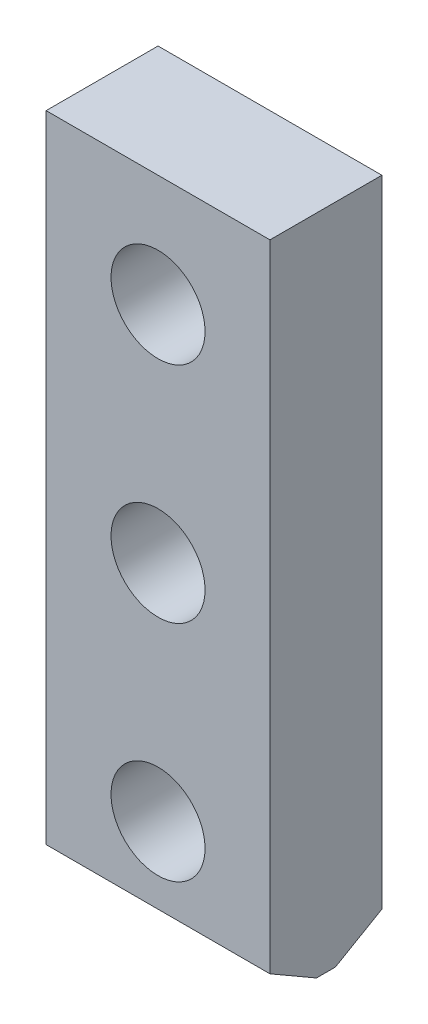
from build123d import *

# Parameters (mm, degrees)
SKETCH_1_W          = 50
SKETCH_1_H          = 148
EXTRUDE_1_DEPTH     = 25
SKETCH_2_R          = 10.5
CUT_EXTRUDE_1_DEPTH = 159.205562481
CHAMFER_1_SIZE      = 6
CHAMFER_1_SIZE2     = 10.392304845
CHAMFER_2_SIZE      = 6
CHAMFER_2_SIZE2     = 10.392304845


with BuildPart() as part:
    # Эскиз1 → Бобышка-Вытянуть1 (new body)
    with BuildSketch(Plane.XY):
        with Locations((25, 74)):
            Rectangle(SKETCH_1_W, SKETCH_1_H)
    extrude(amount=EXTRUDE_1_DEPTH)

    # Эскиз2 → Вырез-Вытянуть1 (cut, through all)
    with BuildSketch(Plane.XY.offset(25)):
        with Locations((25, 23)):
            Circle(SKETCH_2_R)
        with Locations((25, 73)):
            Circle(SKETCH_2_R)
        with Locations((25, 123)):
            Circle(SKETCH_2_R)
    extrude(amount=-CUT_EXTRUDE_1_DEPTH, mode=Mode.SUBTRACT)

    # Фаска1
    chamfer_1_edges = [part.edges().sort_by_distance(p)[0] for p in [
        (25, 0, 0),
    ]]
    chamfer_1_side = [part.faces().sort_by_distance(p)[0] for p in [
        (25, 1.562177967, 0),
    ]]
    chamfer(chamfer_1_edges, length=CHAMFER_1_SIZE, length2=CHAMFER_1_SIZE2, reference=chamfer_1_side[0])

    # Фаска2
    chamfer_2_edges = [part.edges().sort_by_distance(p)[0] for p in [
        (25, 0, 25),
    ]]
    chamfer_2_side = [part.faces().sort_by_distance(p)[0] for p in [
        (25, 1.562177967, 25),
    ]]
    chamfer(chamfer_2_edges, length=CHAMFER_2_SIZE, length2=CHAMFER_2_SIZE2, reference=chamfer_2_side[0])


solid = part.part
